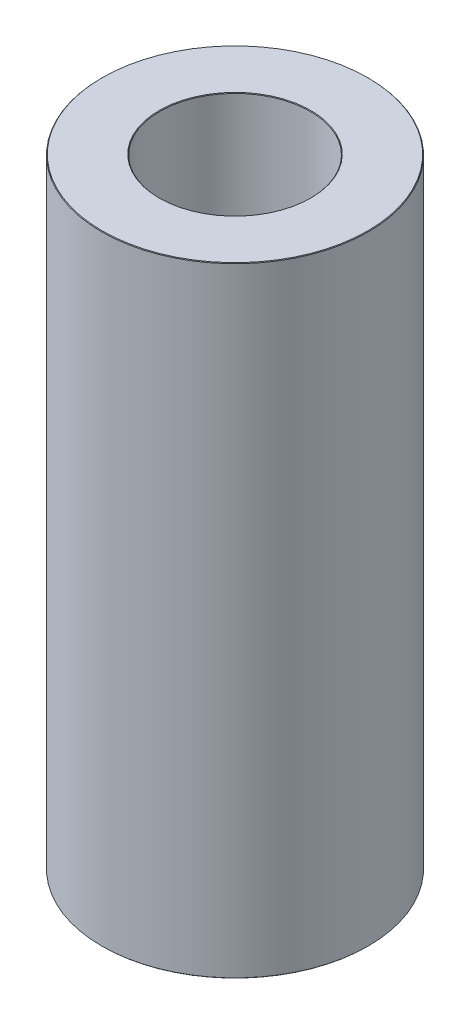
from build123d import *

# Parameters (mm, degrees)
SKETCH1_R           = 55
BOSS_EXTRUDE1_DEPTH = 255.670603571
SKETCH2_R           = 31.073851667
CUT_EXTRUDE1_DEPTH  = 268.240448904
CHAMFER1_SIZE       = 0.22826365


with BuildPart() as part:
    # Sketch1 → Boss-Extrude1 (new body)
    with BuildSketch(Plane(origin=(0, 0, 0), x_dir=(1, 0, 0), z_dir=(0, 1, 0))):
        Circle(SKETCH1_R)
    extrude(amount=BOSS_EXTRUDE1_DEPTH)

    # Sketch2 → Cut-Extrude1 (cut, through all)
    with BuildSketch(Plane(origin=(0, 0, 0), x_dir=(1, 0, 0), z_dir=(0, 1, 0))):
        Circle(SKETCH2_R)
    extrude(amount=CUT_EXTRUDE1_DEPTH, mode=Mode.SUBTRACT)

    # Chamfer1
    chamfer1_edges = [part.edges().sort_by_distance(p)[0] for p in [
        (-31.073851667, 255.670603571, 0),
        (-31.073851667, 0, 0),
        (-55, 0, 0),
        (-55, 255.670603571, 0),
    ]]
    chamfer(chamfer1_edges, length=CHAMFER1_SIZE)


solid = part.part
